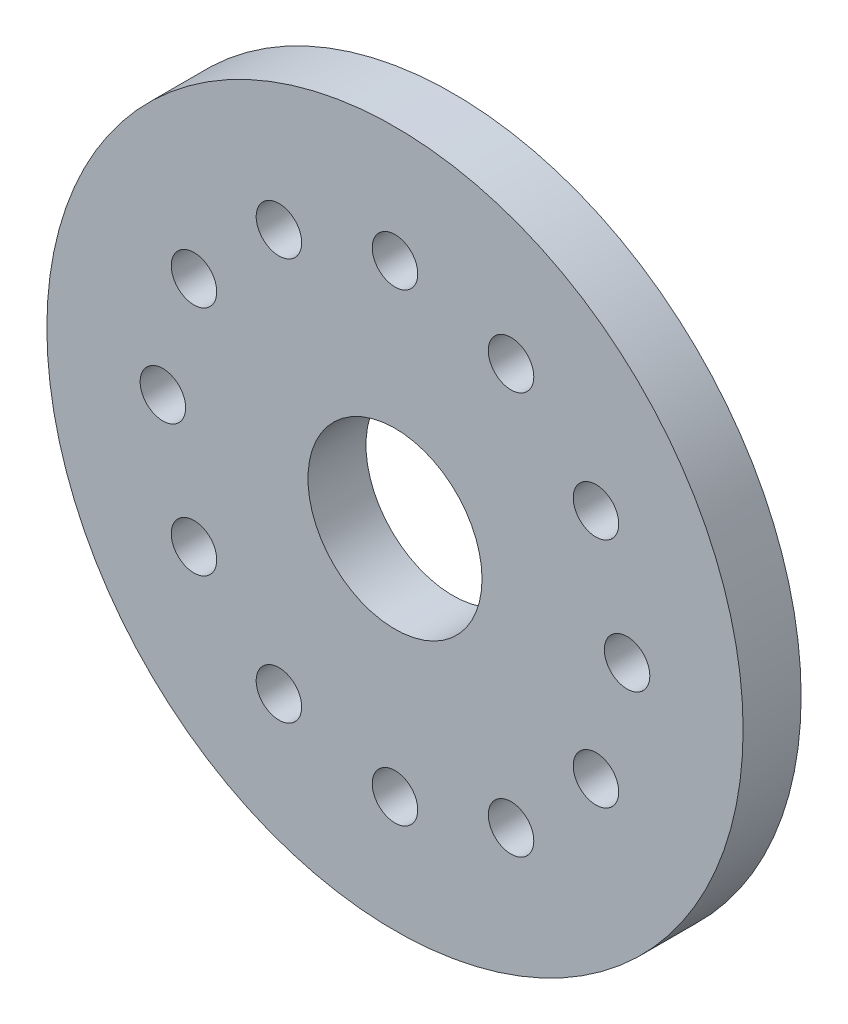
from build123d import *

# Parameters (mm, degrees)
SKETCH1_R           = 38.1
SKETCH1_R_2         = 9.525
SKETCH1_R_3         = 2.4892
BOSS_EXTRUDE1_DEPTH = 6.35


with BuildPart() as part:
    # Sketch1 → Boss-Extrude1 (new body)
    with BuildSketch(Plane.XY):
        Circle(SKETCH1_R)
        Circle(SKETCH1_R_2, mode=Mode.SUBTRACT)
        with Locations((0, 25.4)):
            Circle(SKETCH1_R_3, mode=Mode.SUBTRACT)
        with Locations((12.7, 21.997045256)):
            Circle(SKETCH1_R_3, mode=Mode.SUBTRACT)
        with Locations((21.997045256, 12.7)):
            Circle(SKETCH1_R_3, mode=Mode.SUBTRACT)
        with Locations((25.4, 0)):
            Circle(SKETCH1_R_3, mode=Mode.SUBTRACT)
        with Locations((21.997045256, -12.7)):
            Circle(SKETCH1_R_3, mode=Mode.SUBTRACT)
        with Locations((12.7, -21.997045256)):
            Circle(SKETCH1_R_3, mode=Mode.SUBTRACT)
        with Locations((0, -25.4)):
            Circle(SKETCH1_R_3, mode=Mode.SUBTRACT)
        with Locations((-12.7, -21.997045256)):
            Circle(SKETCH1_R_3, mode=Mode.SUBTRACT)
        with Locations((-21.997045256, -12.7)):
            Circle(SKETCH1_R_3, mode=Mode.SUBTRACT)
        with Locations((-25.4, 0)):
            Circle(SKETCH1_R_3, mode=Mode.SUBTRACT)
        with Locations((-21.997045256, 12.7)):
            Circle(SKETCH1_R_3, mode=Mode.SUBTRACT)
        with Locations((-12.7, 21.997045256)):
            Circle(SKETCH1_R_3, mode=Mode.SUBTRACT)
    extrude(amount=BOSS_EXTRUDE1_DEPTH)


solid = part.part
